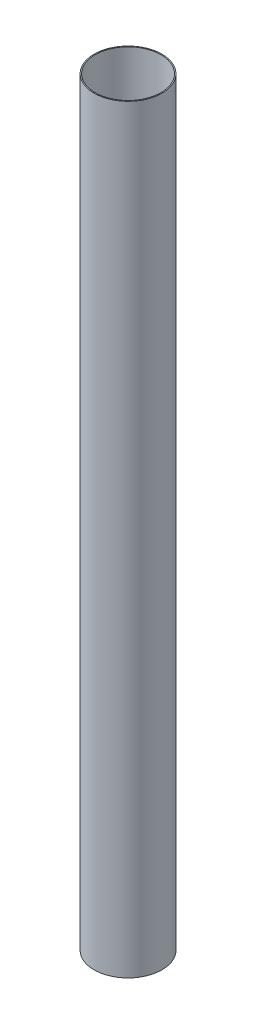
from build123d import *

# Parameters (mm, degrees)
SKETCH2_W = 1143
SKETCH2_H = 1.524


with BuildPart() as part:
    # Sketch2 → Revolve1 (revolve)
    with BuildSketch(Plane(origin=(0, 0, 0), x_dir=(0, 1, 0), z_dir=(0, 0, 1))):
        with Locations((1206.5, 50.292)):
            Rectangle(SKETCH2_W, SKETCH2_H)
    revolve(axis=Axis((0, -88.99, 0), (0, 1, 0)))


solid = part.part
